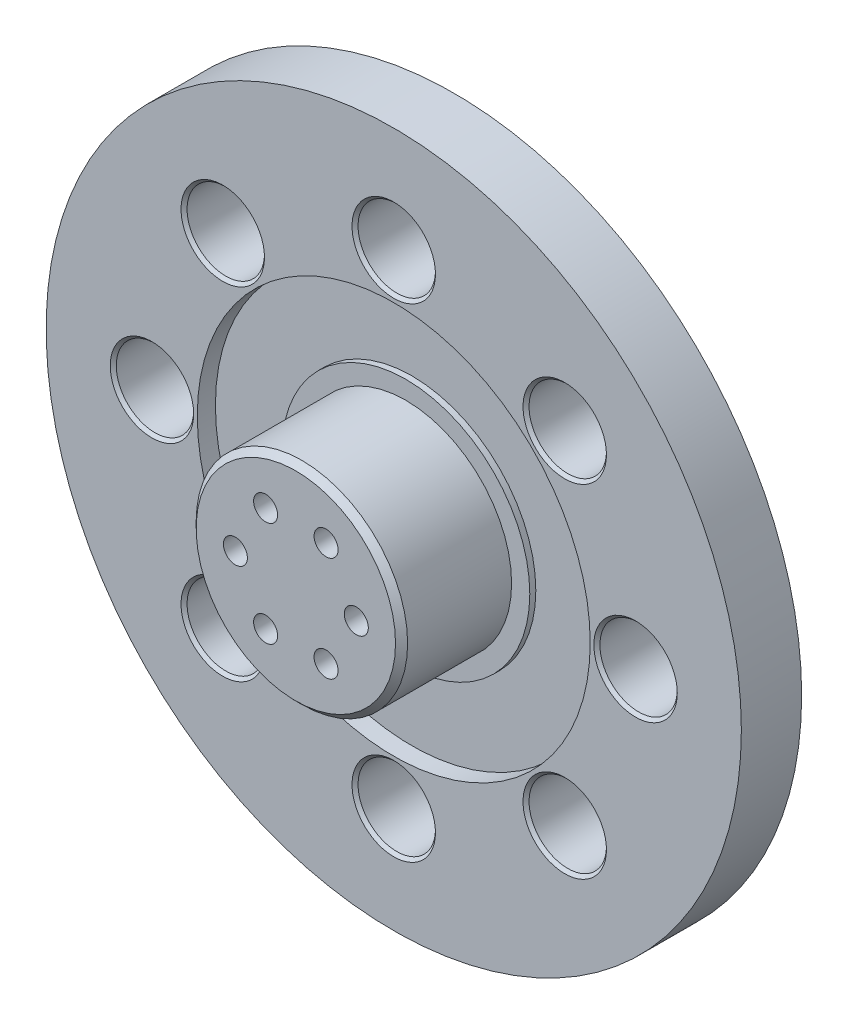
from build123d import *

# Parameters (mm, degrees)
SKETCH1_R                    = 17.49
BOSS_EXTRUDE1_DEPTH          = 18.2
SKETCH7_R                    = 20.5
BOSS_EXTRUDE3_DEPTH          = 0.995
SKETCH3_R                    = 57.5
BOSS_EXTRUDE2_DEPTH          = 6.975
SKETCH4_R                    = 11.015
CUT_EXTRUDE1_DEPTH           = 7
SKETCH5_R                    = 7.5
CUT_EXTRUDE2_DEPTH           = 0.5
SKETCH6_R                    = 1.985
CUT_EXTRUDE3_DEPTH           = 10
CIRPATTERN1_COUNT            = 6
CHAMFER1_SIZE                = 1
BOSS_EXTRUDE5_START          = 3
SKETCH14_R                   = 57.5
SKETCH14_R_2                 = 32.5
BOSS_EXTRUDE5_DEPTH          = 3
SKETCH10_R                   = 6.4
CUT_EXTRUDE6_DEPTH           = 84.552067748
CHAMFER7_SIZE                = 0.5
CIRPATTERN3_COUNT            = 8
CHAMFER7_OF_CIRPATTERN3_SIZE = 0.5


with BuildPart() as part:
    # Sketch1 → Boss-Extrude1 (new body)
    with BuildSketch(Plane.XY):
        Circle(SKETCH1_R)
    extrude(amount=BOSS_EXTRUDE1_DEPTH)

    # Sketch7 → Boss-Extrude3 (add)
    with BuildSketch(Plane(origin=(0, 0, 0), x_dir=(-1, 0, 0), z_dir=(0, 0, -1))):
        Circle(SKETCH7_R)
    extrude(amount=BOSS_EXTRUDE3_DEPTH)

    # Sketch3 → Boss-Extrude2 (add)
    with BuildSketch(Plane(origin=(0, 0, -0.995), x_dir=(-1, 0, 0), z_dir=(0, 0, -1))):
        Circle(SKETCH3_R)
    extrude(amount=BOSS_EXTRUDE2_DEPTH)

    # Sketch4 → Cut-Extrude1 (cut)
    with BuildSketch(Plane(origin=(0, 0, -7.97), x_dir=(-1, 0, 0), z_dir=(0, 0, -1))):
        Circle(SKETCH4_R)
    extrude(amount=-CUT_EXTRUDE1_DEPTH, mode=Mode.SUBTRACT)

    # Sketch5 → Cut-Extrude2 (cut)
    with BuildSketch(Plane(origin=(0, 0, -0.97), x_dir=(-1, 0, 0), z_dir=(0, 0, -1))):
        Circle(SKETCH5_R)
    extrude(amount=-CUT_EXTRUDE2_DEPTH, mode=Mode.SUBTRACT)

    # Sketch6 → Cut-Extrude3 (cut)
    with BuildSketch(Plane.XY.offset(18.2)):
        with Locations((-10, 0)):
            Circle(SKETCH6_R)
    cut_extrude3 = extrude(amount=-CUT_EXTRUDE3_DEPTH, mode=Mode.SUBTRACT)

    # CirPattern1: Cut-Extrude3 ×6 about axis
    cirpattern1_axis = Axis((0, 0, 18.2), (0, 0, 1))
    for i in range(1, CIRPATTERN1_COUNT):
        add(cut_extrude3.rotate(cirpattern1_axis, i * 360 / CIRPATTERN1_COUNT), mode=Mode.SUBTRACT)

    # Chamfer1
    chamfer1_edges = [part.edges().sort_by_distance(p)[0] for p in [
        (11.015, 0, -7.97),
        (-17.49, 0, 18.2),
    ]]
    chamfer(chamfer1_edges, length=CHAMFER1_SIZE)

    # Sketch14 → Boss-Extrude5 (add)
    with BuildSketch(Plane.XY.offset(-0.995).offset(BOSS_EXTRUDE5_START)):
        Circle(SKETCH14_R)
        Circle(SKETCH14_R_2, mode=Mode.SUBTRACT)
    extrude(amount=-BOSS_EXTRUDE5_DEPTH)

    # Sketch10 → Cut-Extrude6 (cut, symmetric)
    with BuildSketch(Plane.XY.offset(-0.995)):
        with Locations((-40, 0)):
            Circle(SKETCH10_R)
    cut_extrude6 = extrude(amount=CUT_EXTRUDE6_DEPTH, both=True, mode=Mode.SUBTRACT)

    # Chamfer7
    chamfer7_edges = [part.edges().sort_by_distance(p)[0] for p in [
        (-46.4, 0, -7.97),
        (-46.4, 0, 2.005),
    ]]
    chamfer(chamfer7_edges, length=CHAMFER7_SIZE)

    # CirPattern3: Cut-Extrude6 ×8 about axis
    cirpattern3_axis = Axis((0, 0, -7.97), (0, 0, 1))
    for i in range(1, CIRPATTERN3_COUNT):
        add(cut_extrude6.rotate(cirpattern3_axis, i * 360 / CIRPATTERN3_COUNT), mode=Mode.SUBTRACT)

    # Chamfer7 of CirPattern3
    chamfer7_of_cirpattern3_edges = [part.edges().sort_by_distance(p)[0] for p in [
        (-32.809754647, -32.809754647, -7.97),
        (-32.809754647, -32.809754647, 2.005),
        (0, -46.4, -7.97),
        (0, -46.4, 2.005),
        (32.809754647, -32.809754647, -7.97),
        (32.809754647, -32.809754647, 2.005),
        (46.4, 0, -7.97),
        (46.4, 0, 2.005),
        (32.809754647, 32.809754647, -7.97),
        (32.809754647, 32.809754647, 2.005),
        (0, 46.4, -7.97),
        (0, 46.4, 2.005),
        (-32.809754647, 32.809754647, -7.97),
        (-32.809754647, 32.809754647, 2.005),
    ]]
    chamfer(chamfer7_of_cirpattern3_edges, length=CHAMFER7_OF_CIRPATTERN3_SIZE)


solid = part.part
